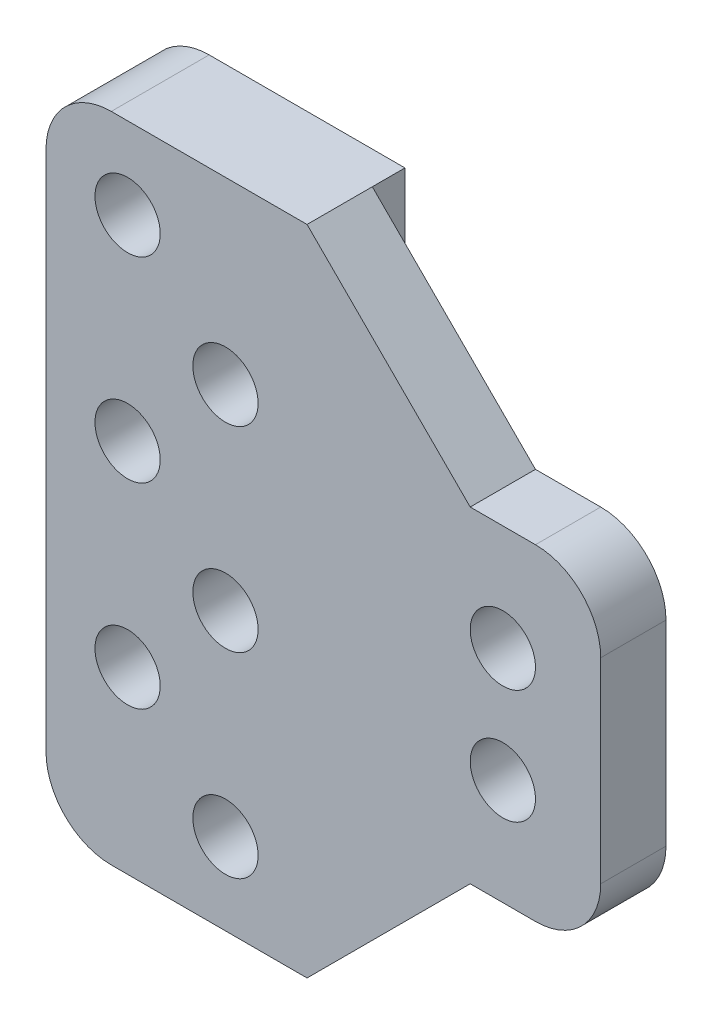
from build123d import *

# Parameters (mm, degrees)
SKETCH1_W           = 6
SKETCH1_H           = 10
SKETCH1_R           = 1
BOSS_EXTRUDE1_DEPTH = 2
BOSS_EXTRUDE2_DEPTH = 2
SKETCH3_W           = 8
SKETCH3_H           = 20
BOSS_EXTRUDE3_DEPTH = 1
SKETCH4_R           = 1
CUT_EXTRUDE1_DEPTH  = 5
LPATTERN1_COUNT     = 3
LPATTERN1_PITCH     = 6
CHAMFER1_SIZE       = 5
FILLET1_R           = 2


with BuildPart() as part:
    # Sketch1 → Boss-Extrude1 (new body)
    with BuildSketch(Plane.XY):
        Rectangle(SKETCH1_W, SKETCH1_H)
        with Locations((0, 1.75)):
            Circle(SKETCH1_R, mode=Mode.SUBTRACT)
        with Locations((0, -1.75)):
            Circle(SKETCH1_R, mode=Mode.SUBTRACT)
    extrude(amount=BOSS_EXTRUDE1_DEPTH)

    # Sketch2 → Boss-Extrude2 (add)
    with BuildSketch(Plane.XY.offset(2)):
        Polygon((-14, -10), (-14, 10), (-6, 10), (-6, 5), (-3, 5), (-3, -5), (-6, -5), (-6, -10), align=None)
    extrude(amount=-BOSS_EXTRUDE2_DEPTH)

    # Sketch3 → Boss-Extrude3 (add)
    with BuildSketch(Plane(origin=(0, 0, 0), x_dir=(-1, 0, 0), z_dir=(0, 0, -1))):
        with Locations((10, 0)):
            Rectangle(SKETCH3_W, SKETCH3_H)
    extrude(amount=BOSS_EXTRUDE3_DEPTH)

    # Sketch4 → Cut-Extrude1 (cut)
    with BuildSketch(Plane.XY.offset(2)):
        with Locations((-8.5, -7.5)):
            Circle(SKETCH4_R)
        with Locations((-11.5, -4.5)):
            Circle(SKETCH4_R)
    cut_extrude1 = extrude(amount=-CUT_EXTRUDE1_DEPTH, mode=Mode.SUBTRACT)

    # LPattern1: Cut-Extrude1 ×3
    with Locations(*[(0, i * LPATTERN1_PITCH, 0) for i in range(1, LPATTERN1_COUNT)]):
        add(cut_extrude1, mode=Mode.SUBTRACT)

    # Chamfer1
    chamfer1_edges = [part.edges().sort_by_distance(p)[0] for p in [
        (-6, 5, 1),
        (-6, -5, 1),
    ]]
    chamfer(chamfer1_edges, length=CHAMFER1_SIZE - 0.0001)  # a hair under: the kernel refuses the full size

    # Fillet1
    fillet1_edges = [part.edges().sort_by_distance(p)[0] for p in [
        (-14, -10, 0.5),
        (-14, 10, 0.5),
        (3, -5, 1),
        (3, 5, 1),
    ]]
    fillet(fillet1_edges, radius=FILLET1_R)


solid = part.part
